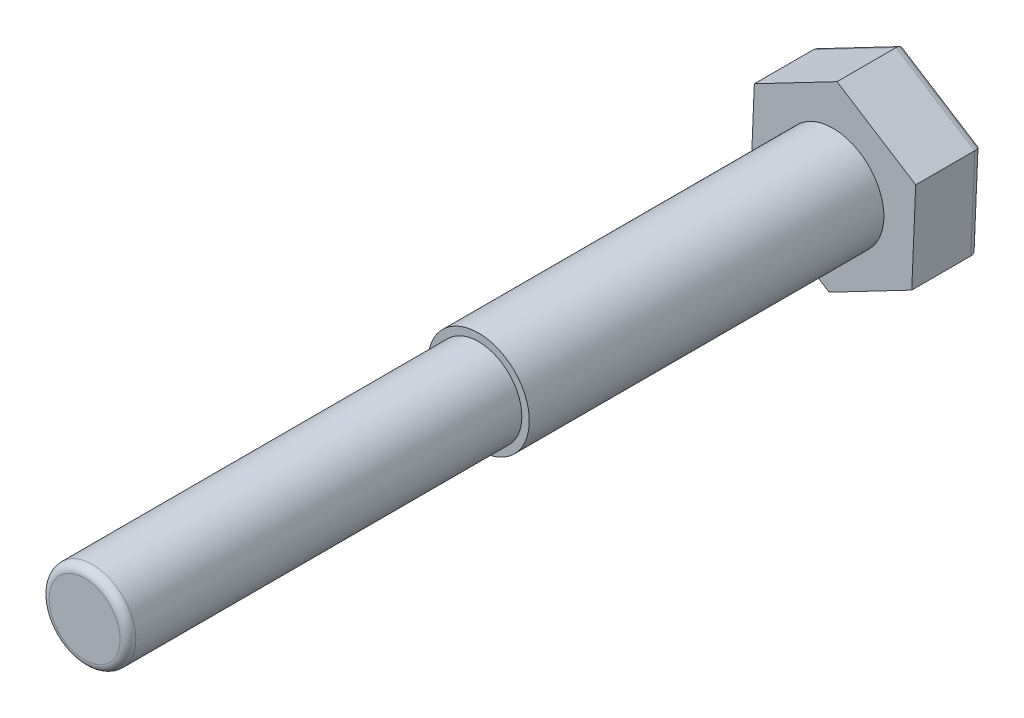
from build123d import *

# Parameters (mm, degrees)
EXTRUDE_307_DEPTH = 17
SKETCH_2_R        = 12.9
EXTRUDE_1_DEPTH   = 90
FILLET_3_R        = 2
SKETCH_3_R        = 11
EXTRUDE_2_DEPTH   = 100
FILLET_4_R        = 2


with BuildPart() as part:
    # 草图1 → Extrude 307 (new body)
    with BuildSketch(Plane.XY):
        Polygon((20.984201837, 10.954296262), (1.005402075, 23.65), (-19.978799762, 12.695703738), (-20.984201837, -10.954296262), (-1.005402075, -23.65), (19.978799762, -12.695703738), align=None)
    extrude(amount=EXTRUDE_307_DEPTH)

    # 草图2 → 凸台-拉伸1 (add)
    with BuildSketch(Plane.XY.offset(17)):
        Circle(SKETCH_2_R)
    extrude(amount=EXTRUDE_1_DEPTH)

    # 圆角3
    fillet_3_edges = [part.edges().sort_by_distance(p)[0] for p in [
        (10.994801956, 17.302148131, 0),
        (-9.486698843, 18.172851869, 0),
        (-20.4815008, 0.870703738, 0),
        (-10.994801956, -17.302148131, 0),
        (9.486698843, -18.172851869, 0),
        (20.4815008, -0.870703738, 0),
    ]]
    fillet(fillet_3_edges, radius=FILLET_3_R)

    # 草图3 → 凸台-拉伸2 (add)
    with BuildSketch(Plane.XY.offset(107)):
        Circle(SKETCH_3_R)
    extrude(amount=EXTRUDE_2_DEPTH)

    # 圆角4
    fillet_4_edges = [part.edges().sort_by_distance(p)[0] for p in [
        (-11, 0, 207),
    ]]
    fillet(fillet_4_edges, radius=FILLET_4_R)


solid = part.part
